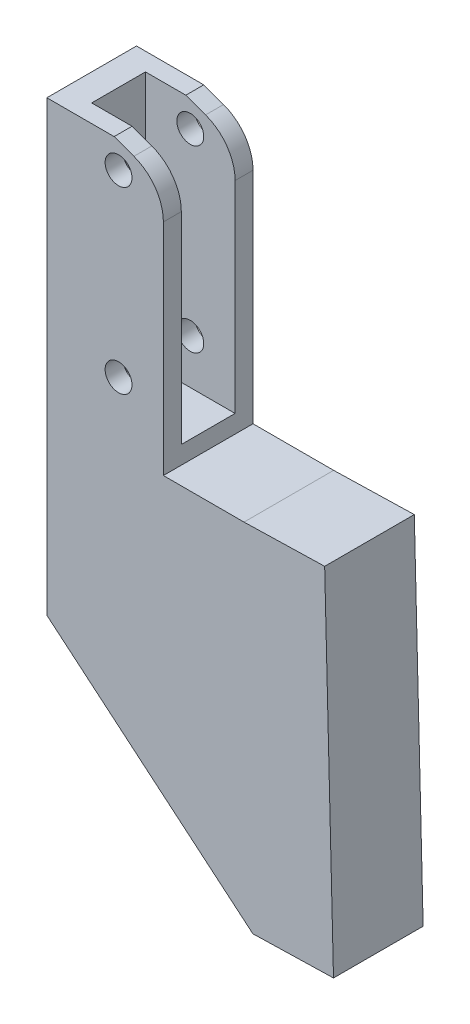
from build123d import *

# Parameters (mm, degrees)
EXTRUDE_1_DEPTH     = 10
SKETCH_2_W          = 6
SKETCH_2_H          = 28
CUT_EXTRUDE_1_DEPTH = 10
SKETCH_3_R          = 1.5
CUT_EXTRUDE_2_DEPTH = 58.605092201
SKETCH_4_R          = 1.5
CUT_EXTRUDE_3_DEPTH = 58.605092201
CHAMFER_1_SIZE      = 2
CHAMFER_1_SIZE2     = 5.494954839
FILLET_2_R          = 5
SKETCH_5_W          = 10
SKETCH_5_H          = 39.295993529
EXTRUDE_2_DEPTH     = 9


with BuildPart() as part:
    # 草图1 → 凸台-拉伸1 (new body)
    with BuildSketch(Plane.XY):
        Polygon((15.495607284, -15), (6.5, -15), (6.5, 15), (-6.5, 15), (-6.5, -35), (16.481333294, -54.283628291), align=None)
    extrude(amount=EXTRUDE_1_DEPTH)

    # 草图2 → 切除-拉伸1 (cut)
    with BuildSketch(Plane(origin=(6.5, 0, 0), x_dir=(0, 0, -1), z_dir=(1, 0, 0))):
        with Locations((-5, 1)):
            Rectangle(SKETCH_2_W, SKETCH_2_H)
    extrude(amount=-CUT_EXTRUDE_1_DEPTH, mode=Mode.SUBTRACT)

    # 草图3 → 切除-拉伸2 (cut, through all)
    with BuildSketch(Plane.XY.offset(10)):
        with Locations((1.5, 12)):
            Circle(SKETCH_3_R)
    extrude(amount=-CUT_EXTRUDE_2_DEPTH, mode=Mode.SUBTRACT)

    # 草图4 → 切除-拉伸3 (cut, through all)
    with BuildSketch(Plane.XY.offset(10)):
        with Locations((1.5, -8)):
            Circle(SKETCH_4_R)
    extrude(amount=-CUT_EXTRUDE_3_DEPTH, mode=Mode.SUBTRACT)

    # 倒角1
    chamfer_1_edges = [part.edges().sort_by_distance(p)[0] for p in [
        (6.5, 15, 9),
        (6.5, 15, 1),
    ]]
    chamfer_1_side = [part.faces().sort_by_distance(p)[0] for p in [
        (6.5, 0, 0.316227766),
    ]]
    chamfer(chamfer_1_edges, length=CHAMFER_1_SIZE, length2=CHAMFER_1_SIZE2, reference=chamfer_1_side[0])

    # 圆角2
    fillet_2_edges = [part.edges().sort_by_distance(p)[0] for p in [
        (6.5, 13, 1),
        (6.5, 13, 9),
    ]]
    fillet(fillet_2_edges, radius=FILLET_2_R)

    # 草图5 → 凸台-拉伸2 (add)
    with BuildSketch(Plane(origin=(15.109705578, 0.37914089, 0), x_dir=(0, 0, -1), z_dir=(0.9996853308084814, 0.025084644034495025, 0))):
        with Locations((-5, -35.03197852)):
            Rectangle(SKETCH_5_W, SKETCH_5_H)
    extrude(amount=EXTRUDE_2_DEPTH)


solid = part.part
